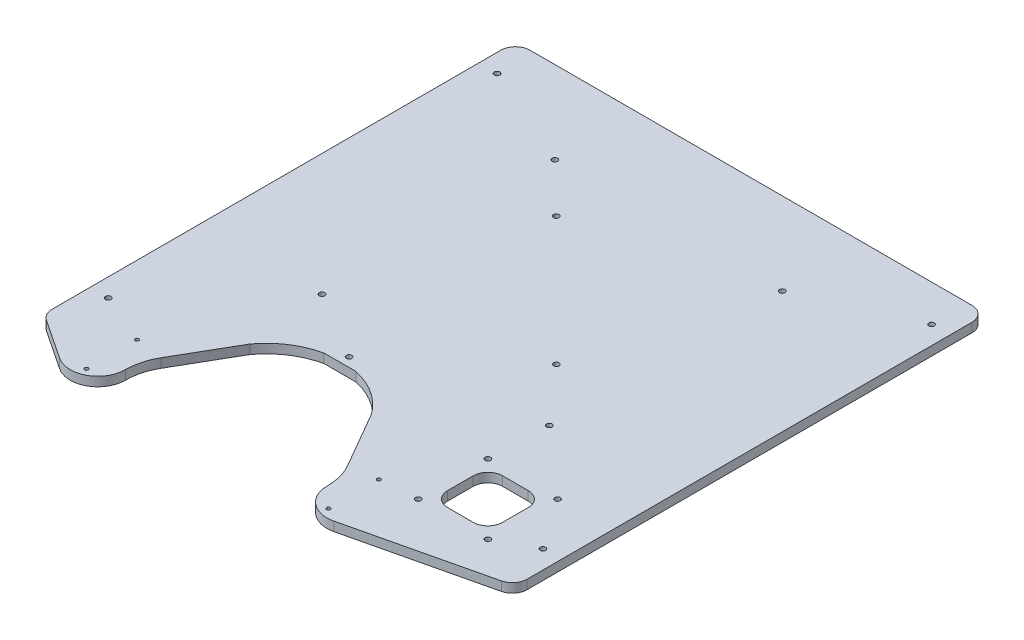
from build123d import *

# Parameters (mm, degrees)
ESQUISSE1_R             = 1
BOSS_EXTRU_1_DEPTH      = 5
ESQUISSE2_R             = 1.5
ENL_V_MAT_EXTRU_1_DEPTH = 277.772225301
ESQUISSE3_R             = 1.5
ENL_V_MAT_EXTRU_2_DEPTH = 277.772225301
ESQUISSE4_R             = 1.5
ENL_V_MAT_EXTRU_3_DEPTH = 277.772225301
ESQUISSE5_R             = 1.5
ENL_V_MAT_EXTRU_5_DEPTH = 277.772225301


with BuildPart() as part:
    # Esquisse1 → Boss.-Extru.1 (new body)
    with BuildSketch(Plane(origin=(0, 0, 0), x_dir=(1, 0, 0), z_dir=(0, 1, 0))):
        with BuildLine():
            Line((-120.5, 31.2), (120.5, 31.2))
            ThreePointArc((120.5, 31.2), (126.156854249, 28.856854249), (128.5, 23.2))
            Line((128.5, 23.2), (128.5, -219.467382599))
            ThreePointArc((128.5, -219.467382599), (126.772639772, -224.43266107), (122.336502426, -227.253733403))
            Line((122.336502426, -227.253733403), (48.443442049, -244.68228088))
            ThreePointArc((48.443442049, -244.68228088), (45.399263454, -245.077558471), (42.33836323, -244.8448408))
            ThreePointArc((42.33836323, -244.8448408), (33.490774319, -239.702526143), (30, -230.082873123))
            ThreePointArc((30, -230.082873123), (28.945508514, -222.073215083), (25.853895909, -214.609402001))
            Line((25.853895909, -214.609402001), (10.681549424, -188.330127019))
            Line((10.681549424, -188.330127019), (8.181549424, -184))
            ThreePointArc((8.181549424, -184), (-2.618897308, -173.730489766), (-16.376585234, -168))
            Line((-16.376585234, -168), (-33.623414766, -168))
            ThreePointArc((-33.623414766, -168), (-47.381102692, -173.730489766), (-58.181549424, -184))
            Line((-58.181549424, -184), (-60.681549424, -188.330127019))
            Line((-60.681549424, -188.330127019), (-75.853895909, -214.609402001))
            ThreePointArc((-75.853895909, -214.609402001), (-78.945508514, -222.073215083), (-80, -230.082873123))
            ThreePointArc((-80, -230.082873123), (-81.87001368, -237.335697347), (-87.013794564, -242.780137503))
            ThreePointArc((-87.013794564, -242.780137503), (-95.194460163, -245.081612578), (-103.312708305, -242.568820449))
            Line((-103.312708305, -242.568820449), (-124.933444429, -228.174488322))
            ThreePointArc((-124.933444429, -228.174488322), (-127.552217929, -225.292381715), (-128.5, -221.515316414))
            Line((-128.5, -221.515316414), (-128.5, 23.2))
            ThreePointArc((-128.5, 23.2), (-126.156854249, 28.856854249), (-120.5, 31.2))
        make_face()
        with Locations((41, -212.75)):
            Circle(ESQUISSE1_R, mode=Mode.SUBTRACT)
        with Locations((41, -240.25)):
            Circle(ESQUISSE1_R, mode=Mode.SUBTRACT)
        with Locations((-91, -212.75)):
            Circle(ESQUISSE1_R, mode=Mode.SUBTRACT)
        with Locations((-91, -240.25)):
            Circle(ESQUISSE1_R, mode=Mode.SUBTRACT)
    extrude(amount=-BOSS_EXTRU_1_DEPTH)

    # Esquisse2 → Enlèv. mat.-Extru.1 (cut, through all)
    with BuildSketch(Plane(origin=(0, 0, 0), x_dir=(1, 0, 0), z_dir=(0, 1, 0))):
        with Locations((-118.5, 11.2)):
            Circle(ESQUISSE2_R)
        with Locations((-25, -163)):
            Circle(ESQUISSE2_R)
        with Locations((118.5, 11.2)):
            Circle(ESQUISSE2_R)
        with Locations((118.5, -200.8)):
            Circle(ESQUISSE2_R)
        with Locations((-118.5, -200.8)):
            Circle(ESQUISSE2_R)
    extrude(amount=-ENL_V_MAT_EXTRU_1_DEPTH, mode=Mode.SUBTRACT)

    # Esquisse3 → Enlèv. mat.-Extru.2 (cut, through all)
    with BuildSketch(Plane(origin=(0, 0, 0), x_dir=(1, 0, 0), z_dir=(0, 1, 0))):
        with Locations((62, -140.8)):
            Circle(ESQUISSE3_R)
        with Locations((-62, -140.8)):
            Circle(ESQUISSE3_R)
        with Locations((62, -13.8)):
            Circle(ESQUISSE3_R)
        with Locations((-62, -13.8)):
            Circle(ESQUISSE3_R)
    extrude(amount=-ENL_V_MAT_EXTRU_2_DEPTH, mode=Mode.SUBTRACT)

    # Esquisse4 → Enlèv. mat.-Extru.3 (cut, through all)
    with BuildSketch(Plane(origin=(0, 0, 0), x_dir=(1, 0, 0), z_dir=(0, 1, 0))):
        with Locations((-35, -40)):
            Circle(ESQUISSE4_R)
        with Locations((35, -110)):
            Circle(ESQUISSE4_R)
    extrude(amount=-ENL_V_MAT_EXTRU_3_DEPTH, mode=Mode.SUBTRACT)

    # Esquisse5 → Enlèv. mat.-Extru.5 (cut, through all)
    with BuildSketch(Plane(origin=(0, 0, 0), x_dir=(1, 0, 0), z_dir=(0, 1, 0))):
        with Locations((61, -211.3)):
            Circle(ESQUISSE5_R)
        with Locations((99, -211.3)):
            Circle(ESQUISSE5_R)
        with Locations((99, -173.3)):
            Circle(ESQUISSE5_R)
        with Locations((61, -173.3)):
            Circle(ESQUISSE5_R)
        with BuildLine():
            Line((73, -177.3), (87, -177.3))
            ThreePointArc((87, -177.3), (92.656854249, -179.643145751), (95, -185.3))
            Line((95, -185.3), (95, -199.3))
            ThreePointArc((95, -199.3), (92.656854249, -204.956854249), (87, -207.3))
            Line((87, -207.3), (73, -207.3))
            ThreePointArc((73, -207.3), (67.343145751, -204.956854249), (65, -199.3))
            Line((65, -199.3), (65, -185.3))
            ThreePointArc((65, -185.3), (67.343145751, -179.643145751), (73, -177.3))
        make_face()
    extrude(amount=-ENL_V_MAT_EXTRU_5_DEPTH, mode=Mode.SUBTRACT)


solid = part.part
